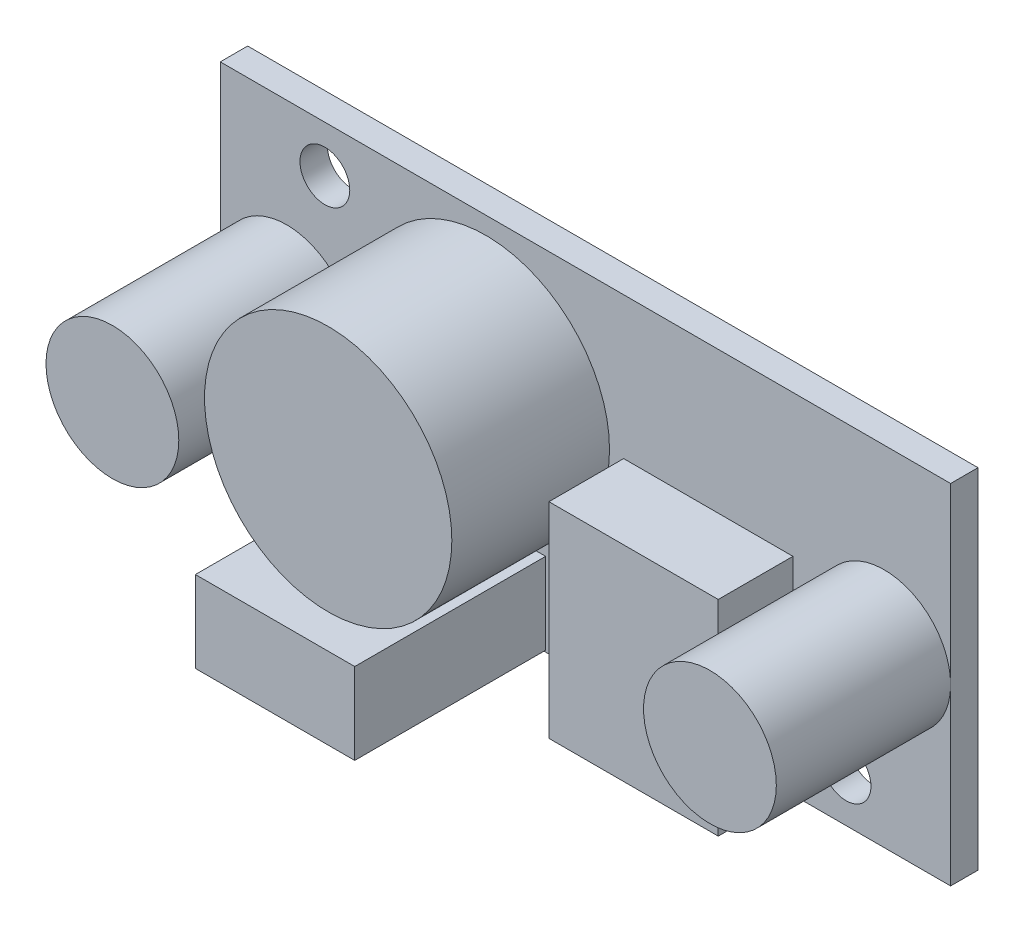
from build123d import *

# Parameters (mm, degrees)
SKETCH_1_W         = 44
SKETCH_1_H         = 21
SKETCH_1_R         = 1.5
EXTRUDE_482_DEPTH  = 1.65
SKETCH_2_R         = 4
EXTRUDE_1076_DEPTH = 10.5
SKETCH_2_3_W       = 9.6
SKETCH_2_3_H       = 4.9
EXTRUDE_1121_DEPTH = 11.5
SKETCH_2_4_R       = 7.45
EXTRUDE_1261_DEPTH = 9.5
SKETCH_2_5_W       = 10.2
SKETCH_2_5_H       = 12.35
EXTRUDE_1345_DEPTH = 4.5


with BuildPart() as part:
    # Эскиз1 → Extrude 482 (new body)
    with BuildSketch(Plane.XY):
        Rectangle(SKETCH_1_W, SKETCH_1_H)
        with Locations((-15.7, 7.7)):
            Circle(SKETCH_1_R, mode=Mode.SUBTRACT)
        with Locations((15.7, -7.7)):
            Circle(SKETCH_1_R, mode=Mode.SUBTRACT)
    extrude(amount=EXTRUDE_482_DEPTH)

    # Эскиз2 → Extrude 1076 (add)
    with BuildSketch(Plane.XY.offset(1.65)):
        with Locations((-18, 0)):
            Circle(SKETCH_2_R)
        with Locations((18, 0)):
            Circle(SKETCH_2_R)
    extrude(amount=EXTRUDE_1076_DEPTH)

    # Эскиз2<3> → Extrude 1121 (add)
    with BuildSketch(Plane.XY.offset(1.65)):
        with Locations((-7.2, -7.95)):
            Rectangle(SKETCH_2_3_W, SKETCH_2_3_H)
    extrude(amount=EXTRUDE_1121_DEPTH)

    # Эскиз2<4> → Extrude 1261 (add)
    with BuildSketch(Plane.XY.offset(1.65)):
        with Locations((-6, 2)):
            Circle(SKETCH_2_4_R)
    extrude(amount=EXTRUDE_1261_DEPTH)

    # Эскиз2<5> → Extrude 1345 (add)
    with BuildSketch(Plane.XY.offset(1.65)):
        with Locations((7.4, -4.225)):
            Rectangle(SKETCH_2_5_W, SKETCH_2_5_H)
    extrude(amount=EXTRUDE_1345_DEPTH)


solid = part.part
